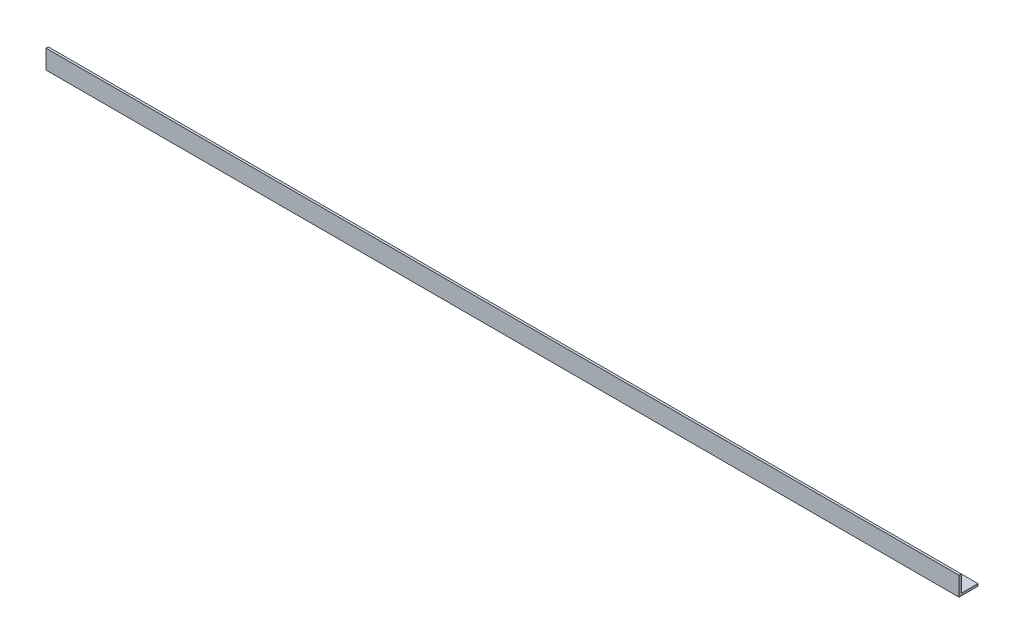
from build123d import *

# Parameters (mm, degrees)
EXTRUDE_1_DEPTH = 1200


with BuildPart() as part:
    # Эскиз1 → Вытянуть-Тонкостенный1 (new body)
    with BuildSketch(Plane(origin=(0, 0, 0), x_dir=(0, 0, -1), z_dir=(1, 0, 0))):
        Polygon((25, 0), (0, 0), (0, 25), (3, 25), (3, 3), (25, 3), align=None)
    extrude(amount=EXTRUDE_1_DEPTH)


solid = part.part
